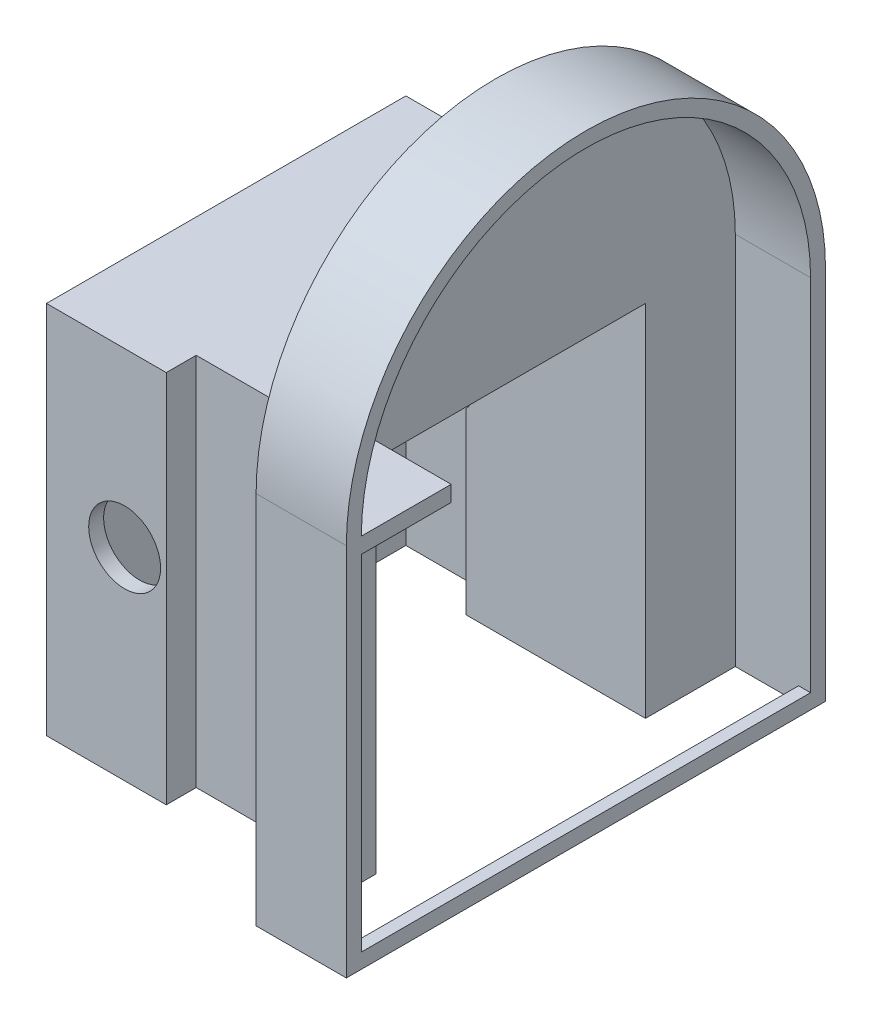
from build123d import *
from OCP.BRepAlgoAPI import BRepAlgoAPI_Cut
from OCP.TopTools import TopTools_ListOfShape

# Parameters (mm, degrees)
BOSS_EXTRUDE2_DEPTH          = 150
SKETCH4_W                    = 40
SKETCH4_H                    = 124.999999274
CUT_EXTRUDE4_DEPTH           = 20
SKETCH8_W                    = 50
SKETCH8_H                    = 124.997967802
CUT_EXTRUDE8_DEPTH           = 30
CUT_EXTRUDE10_DEPTH          = 231.489840965
CUT_EXTRUDE10_DEPTH_BACK     = 231.489840965
CUT_EXTRUDE11_DEPTH          = 225.566109405
CUT_EXTRUDE11_DEPTH_BACK     = 225.566109405
SKETCH11_W                   = 112.022201576
SKETCH11_H                   = 106.194456985
CUT_EXTRUDE12_DEPTH          = 55
SKETCH13_W                   = 40
SKETCH13_H                   = 124.999999274
CUT_EXTRUDE13_DEPTH          = 20
SKETCH14_W                   = 50
SKETCH14_H                   = 124.999999274
CUT_EXTRUDE15_DEPTH          = 30
CUT_EXTRUDE17_DEPTH          = 120
SKETCH17_W                   = 30
SKETCH17_H                   = 5.259472701
BOSS_EXTRUDE3_DEPTH          = 55
CUT_EXTRUDE18_DEPTH          = 225.566109405
CUT_EXTRUDE18_DEPTH_BACK     = 225.566109405
SKETCH20_R                   = 12
CUT_EXTRUDE_THIN2_DEPTH      = 244.166481024
CUT_EXTRUDE_THIN2_DEPTH_BACK = 244.166481024
SKETCH21_W                   = 50
SKETCH21_H                   = 219.250605911
SKETCH22_W                   = 4
SKETCH22_H                   = 160
BOSS_EXTRUDE4_DEPTH          = 5
SKETCH25_W                   = 30
SKETCH25_H                   = 57.6
BOSS_EXTRUDE5_DEPTH          = 18
SKETCH25_4_W                 = 24
SKETCH25_4_H                 = 51.6
CUT_EXTRUDE19_DEPTH          = 13
SKETCH26_W                   = 0.687822724
SKETCH26_H                   = 5.268229282
SKETCH26_H_2                 = 2.219145295
CUT_EXTRUDE21_DEPTH          = 1
CUT_EXTRUDE22_DEPTH          = 5
CUT_EXTRUDE22_DEPTH_BACK     = 5
SKETCH28_R                   = 0.75


with BuildPart() as part:
    # Sketch1 → Boss-Extrude2 (new body)
    with BuildSketch(Plane(origin=(0, 0, 0), x_dir=(0, 0, -1), z_dir=(1, 0, 0))):
        with BuildLine():
            Line((-37.52319824, 25.023509242), (-37.52319824, -99.976490758))
            Line((-37.52319824, -99.976490758), (122.47680176, -99.976490758))
            Line((122.47680176, -99.976490758), (122.47680176, 25.023509242))
            ThreePointArc((122.47680176, 25.023509242), (42.47680176, 105.023509242), (-37.52319824, 25.023509242))
        make_face()
    extrude(amount=BOSS_EXTRUDE2_DEPTH)

    # Sketch4 → Cut-Extrude4 (cut)
    with BuildSketch(Plane.XY.offset(37.52319824)):
        with Locations((20, -37.476491121)):
            Rectangle(SKETCH4_W, SKETCH4_H)
    extrude(amount=-CUT_EXTRUDE4_DEPTH, mode=Mode.SUBTRACT)

    # Sketch8 → Cut-Extrude8 (cut)
    with BuildSketch(Plane.XY.offset(37.52319824)):
        with Locations((65, -37.477506857)):
            Rectangle(SKETCH8_W, SKETCH8_H)
    extrude(amount=-CUT_EXTRUDE8_DEPTH, mode=Mode.SUBTRACT)

    # Sketch9 → Cut-Extrude10 (cut, two sides: drawn at the far end of the back side and taken through both)
    with BuildSketch(Plane.XZ.offset(-25.023508516).offset(-CUT_EXTRUDE10_DEPTH_BACK)):
        Polygon((0, 37.52319824), (0, 17.52319824), (40, 17.52319824), (40, 7.52319824), (90, 7.52319824), (90, 37.52319824), align=None)
    extrude(amount=CUT_EXTRUDE10_DEPTH + CUT_EXTRUDE10_DEPTH_BACK, mode=Mode.SUBTRACT)

    # Sketch11 → Cut-Extrude11 (cut, two sides: drawn at the far end of the back side and taken through both)
    with BuildSketch(Plane.XY.offset(7.52319824).offset(-CUT_EXTRUDE11_DEPTH_BACK)):
        with Locations((33.988899212, 78.120737735)):
            Rectangle(SKETCH11_W, SKETCH11_H)
    extrude(amount=CUT_EXTRUDE11_DEPTH + CUT_EXTRUDE11_DEPTH_BACK, mode=Mode.SUBTRACT)

    # Sketch12 → Cut-Extrude12 (cut)
    with BuildSketch(Plane(origin=(150, 0, 0), x_dir=(0, 0, -1), z_dir=(1, 0, 0))):
        with BuildLine():
            ThreePointArc((117.47680176, 25.023509242), (42.47680176, 100.023509242), (-32.52319824, 25.023509242))
            Line((-32.52319824, 25.023509242), (-32.52319824, -94.976490758))
            Line((-32.52319824, -94.976490758), (117.47680176, -94.976490758))
            Line((117.47680176, -94.976490758), (117.47680176, 25.023509242))
        make_face()
    extrude(amount=-CUT_EXTRUDE12_DEPTH, mode=Mode.SUBTRACT)


with BuildPart() as cut_extrude13_tool:
    # Sketch13 → Cut-Extrude13 (new body)
    with BuildSketch(Plane(origin=(0, 0, -122.47680176), x_dir=(-1, 0, 0), z_dir=(0, 0, -1))):
        with Locations((-20, -37.476490395)):
            Rectangle(SKETCH13_W, SKETCH13_H)
    extrude(amount=-CUT_EXTRUDE13_DEPTH)


with BuildPart() as part_1:
    add(part.part)

    # Cut-Extrude13: cut by cut_extrude13_tool, with a tolerance
    cut_extrude13_stock = TopTools_ListOfShape()
    cut_extrude13_stock.Append(part_1.part.wrapped)
    cut_extrude13_tools = TopTools_ListOfShape()
    cut_extrude13_tools.Append(cut_extrude13_tool.part.wrapped)
    cut_extrude13_cut = BRepAlgoAPI_Cut()
    cut_extrude13_cut.SetArguments(cut_extrude13_stock)
    cut_extrude13_cut.SetTools(cut_extrude13_tools)
    cut_extrude13_cut.SetFuzzyValue(0.00001)
    cut_extrude13_cut.Build()
    add(Compound.cast(cut_extrude13_cut.Shape()).solids(), mode=Mode.REPLACE)


with BuildPart() as cut_extrude15_tool:
    # Sketch14 → Cut-Extrude15 (new body)
    with BuildSketch(Plane(origin=(0, 0, -122.47680176), x_dir=(-1, 0, 0), z_dir=(0, 0, -1))):
        with Locations((-65, -37.476490395)):
            Rectangle(SKETCH14_W, SKETCH14_H)
    extrude(amount=-CUT_EXTRUDE15_DEPTH)


with BuildPart() as part_2:
    add(part_1.part)

    # Cut-Extrude15: cut by cut_extrude15_tool, with a tolerance
    cut_extrude15_stock = TopTools_ListOfShape()
    cut_extrude15_stock.Append(part_2.part.wrapped)
    cut_extrude15_tools = TopTools_ListOfShape()
    cut_extrude15_tools.Append(cut_extrude15_tool.part.wrapped)
    cut_extrude15_cut = BRepAlgoAPI_Cut()
    cut_extrude15_cut.SetArguments(cut_extrude15_stock)
    cut_extrude15_cut.SetTools(cut_extrude15_tools)
    cut_extrude15_cut.SetFuzzyValue(0.00001)
    cut_extrude15_cut.Build()
    add(Compound.cast(cut_extrude15_cut.Shape()).solids(), mode=Mode.REPLACE)

    # Sketch16 → Cut-Extrude17 (cut)
    with BuildSketch(Plane.XZ.offset(99.976490758)):
        Polygon((95, -87.47680176), (95, -117.47680176), (145, -117.47680176), (145, 32.52319824), (95, 32.52319824), (95, 2.52319824), (35, 2.52319824), (35, 12.52319824), (5, 12.52319824), (5, -97.47680176), (35, -97.47680176), (35, -87.47680176), align=None)
    extrude(amount=-CUT_EXTRUDE17_DEPTH, mode=Mode.SUBTRACT)

    # Sketch17 → Boss-Extrude3 (add)
    with BuildSketch(Plane(origin=(95, 0, 0), x_dir=(0, 0, -1), z_dir=(1, 0, 0))):
        with Locations((-17.52319824, 22.653245593)):
            Rectangle(SKETCH17_W, SKETCH17_H)
    extrude(amount=BOSS_EXTRUDE3_DEPTH)

    # Sketch20 → Cut-Extrude18 (cut, two sides: drawn at the far end of the back side and taken through both)
    with BuildSketch(Plane.XY.offset(7.52319824).offset(-CUT_EXTRUDE18_DEPTH_BACK)):
        with Locations((26.097811204, -32.450551048)):
            Circle(SKETCH20_R)
    extrude(amount=CUT_EXTRUDE18_DEPTH + CUT_EXTRUDE18_DEPTH_BACK, mode=Mode.SUBTRACT)

    # Sketch21 → Cut-Extrude-Thin2 (cut, two sides: drawn at the far end of the back side and taken through both)
    with BuildSketch(Plane(origin=(0, 0, -122.47680176), x_dir=(-1, 0, 0), z_dir=(0, 0, -1)).offset(-CUT_EXTRUDE_THIN2_DEPTH_BACK)):
        with Locations((-145.127265144, 6.610737582)):
            Rectangle(SKETCH21_W, SKETCH21_H)
    extrude(amount=CUT_EXTRUDE_THIN2_DEPTH + CUT_EXTRUDE_THIN2_DEPTH_BACK, mode=Mode.SUBTRACT)

    # Sketch22 → Boss-Extrude4 (add)
    with BuildSketch(Plane.XZ.offset(99.976490758)):
        with Locations((118.127265144, -42.47680176)):
            Rectangle(SKETCH22_W, SKETCH22_H)
    extrude(amount=-BOSS_EXTRUDE4_DEPTH)

    # Sketch25 → Boss-Extrude5 (add)
    with BuildSketch(Plane.ZY):
        with Locations((-42.190239987, -37.637506258)):
            Rectangle(SKETCH25_W, SKETCH25_H)
    extrude(amount=-BOSS_EXTRUDE5_DEPTH)

    # Sketch25<4> → Cut-Extrude19 (cut)
    with BuildSketch(Plane.ZY):
        with Locations((-42.190239987, -37.637506258)):
            Rectangle(SKETCH25_4_W, SKETCH25_4_H)
    extrude(amount=-CUT_EXTRUDE19_DEPTH, mode=Mode.SUBTRACT)

    # Sketch26 → Cut-Extrude21 (cut)
    with BuildSketch(Plane(origin=(0, -63.437506258, 0), x_dir=(1, 0, 0), z_dir=(0, 1, 0))):
        with Locations((0.643930004, 33.960425166)):
            Rectangle(SKETCH26_W, SKETCH26_H)
        with Locations((0.643930004, 53.134905876)):
            Rectangle(SKETCH26_W, SKETCH26_H_2)
    extrude(amount=-CUT_EXTRUDE21_DEPTH, mode=Mode.SUBTRACT)

    # Sketch28 → Cut-Extrude22 (cut, two sides: drawn at the far end of the back side and taken through both)
    with BuildSketch(Plane(origin=(0, -8.837506258, 0), x_dir=(1, 0, 0), z_dir=(0, 1, 0)).offset(-CUT_EXTRUDE22_DEPTH_BACK)):
        with Locations((10.149113082, 44.540239987)):
            Circle(SKETCH28_R)
        with Locations((10.149113082, 39.840239987)):
            Circle(SKETCH28_R)
    extrude(amount=CUT_EXTRUDE22_DEPTH + CUT_EXTRUDE22_DEPTH_BACK, mode=Mode.SUBTRACT)


solid = part_2.part
